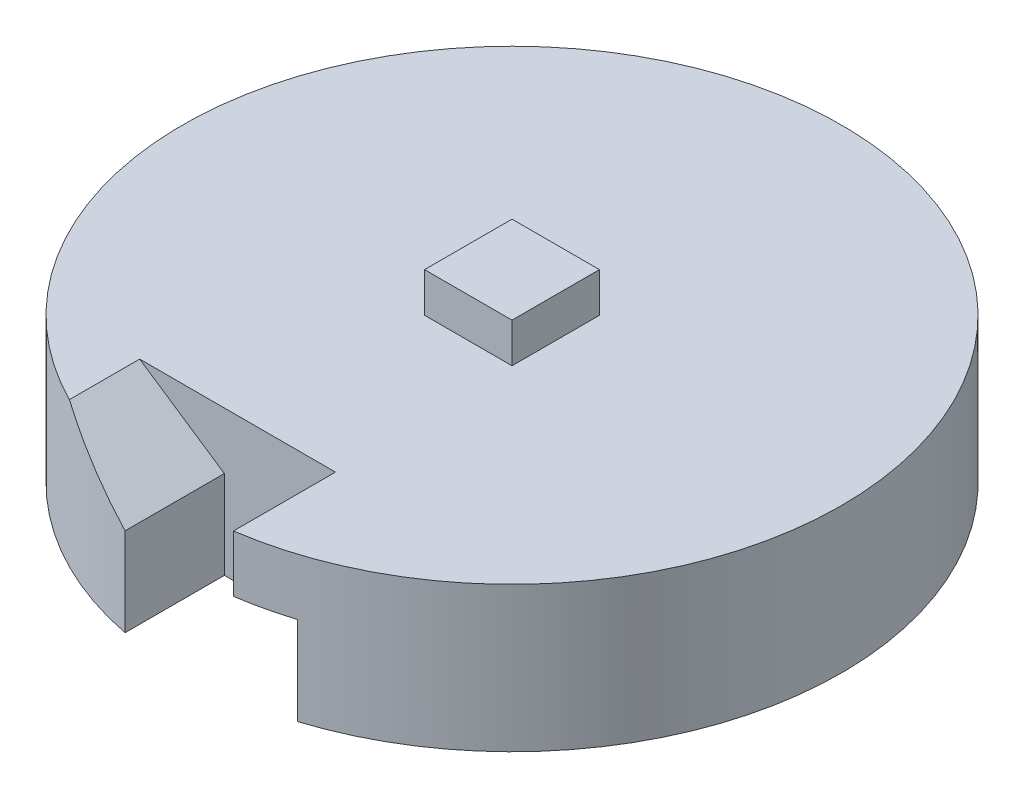
from build123d import *

# Parameters (mm, degrees)
SKETCH1_R           = 37.5
BOSS_EXTRUDE1_DEPTH = 16.5
CUT_EXTRUDE3_DEPTH  = 12
SKETCH9_W           = 9.95
SKETCH9_H           = 9.95
BOSS_EXTRUDE2_DEPTH = 21
SKETCH2_R           = 5
CUT_EXTRUDE5_DEPTH  = 8


with BuildPart() as part:
    # Sketch1 → Boss-Extrude1 (new body)
    with BuildSketch(Plane(origin=(0, 0, 0), x_dir=(1, 0, 0), z_dir=(0, 1, 0))):
        Circle(SKETCH1_R)
    extrude(amount=BOSS_EXTRUDE1_DEPTH)

    # Sketch7 → Cut-Extrude3 (cut)
    with BuildSketch(Plane.XY.offset(37.5)):
        Polygon((5.409167976, 16.55869391), (-16.957427788, 16.55869391), (-7.232029952, 10.040131917), (-7.232029952, -0.186148413), (11.337754855, -0.186148413), (11.337754855, 10.05869391), (5.409167976, 10.05869391), align=None)
    extrude(amount=-CUT_EXTRUDE3_DEPTH, mode=Mode.SUBTRACT)

    # Sketch9 → Boss-Extrude2 (add)
    with BuildSketch(Plane(origin=(0, 0, 0), x_dir=(1, 0, 0), z_dir=(0, 1, 0))):
        Rectangle(SKETCH9_W, SKETCH9_H)
    extrude(amount=BOSS_EXTRUDE2_DEPTH)

    # Sketch2 → Cut-Extrude5 (cut)
    with BuildSketch(Plane.XZ):
        Circle(SKETCH2_R)
    extrude(amount=-CUT_EXTRUDE5_DEPTH, mode=Mode.SUBTRACT)


solid = part.part
